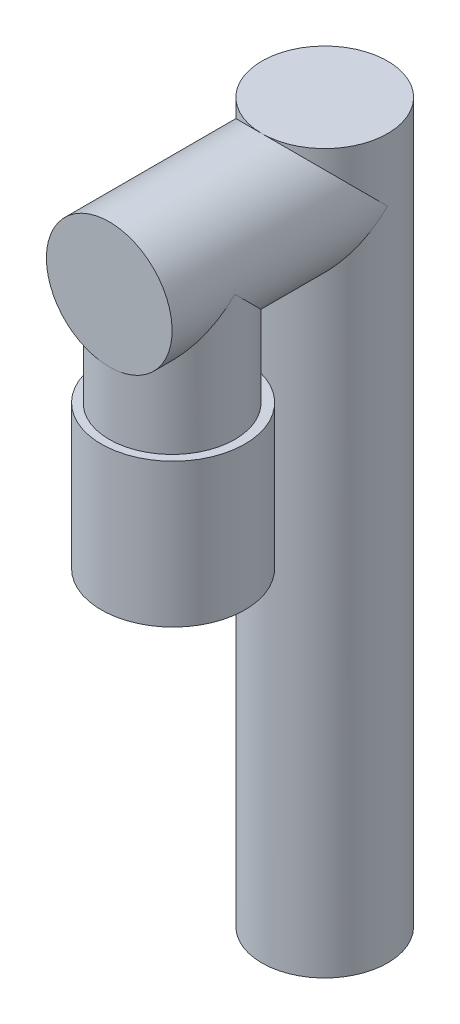
from build123d import *
from build123d.topology import SkipClean

# Parameters (mm, degrees)
SKETCH1_R           = 3.5
BOSS_EXTRUDE1_DEPTH = 40
SKETCH2_R           = 3.5
BOSS_EXTRUDE2_DEPTH = 12
SKETCH3_R           = 3.5
BOSS_EXTRUDE3_DEPTH = 7
SKETCH4_R           = 4
SKETCH4_R_2         = 1
BOSS_EXTRUDE4_DEPTH = 8


with BuildPart() as part:
    # Sketch1 → Boss-Extrude1 (new body)
    with BuildSketch(Plane(origin=(0, 0, 0), x_dir=(1, 0, 0), z_dir=(0, 1, 0))):
        Circle(SKETCH1_R)
    extrude(amount=BOSS_EXTRUDE1_DEPTH)

    # Sketch2 → Boss-Extrude2 (add)
    with SkipClean():  # the faces are left unmerged after this step: merging them gives an invalid solid
        with BuildSketch(Plane.XY):
            with Locations((0, 36.5)):
                Circle(SKETCH2_R)
        extrude(amount=BOSS_EXTRUDE2_DEPTH)

    # Sketch3 → Boss-Extrude3 (add)
    with SkipClean():  # the faces are left unmerged after this step: merging them gives an invalid solid
        with BuildSketch(Plane(origin=(0, 36.5, 0), x_dir=(1, 0, 0), z_dir=(0, 1, 0))):
            with Locations((0, -8.5)):
                Circle(SKETCH3_R)
        extrude(amount=-BOSS_EXTRUDE3_DEPTH)

    # Sketch4 → Boss-Extrude4 (add)
    with SkipClean():  # the faces are left unmerged after this step: merging them gives an invalid solid
        with BuildSketch(Plane.XZ.offset(-29.5)):
            with Locations((0, 8.44493681)):
                Circle(SKETCH4_R)
            with Locations((0, 8.44493681)):
                Circle(SKETCH4_R_2, mode=Mode.SUBTRACT)
        extrude(amount=BOSS_EXTRUDE4_DEPTH)


solid = part.part
